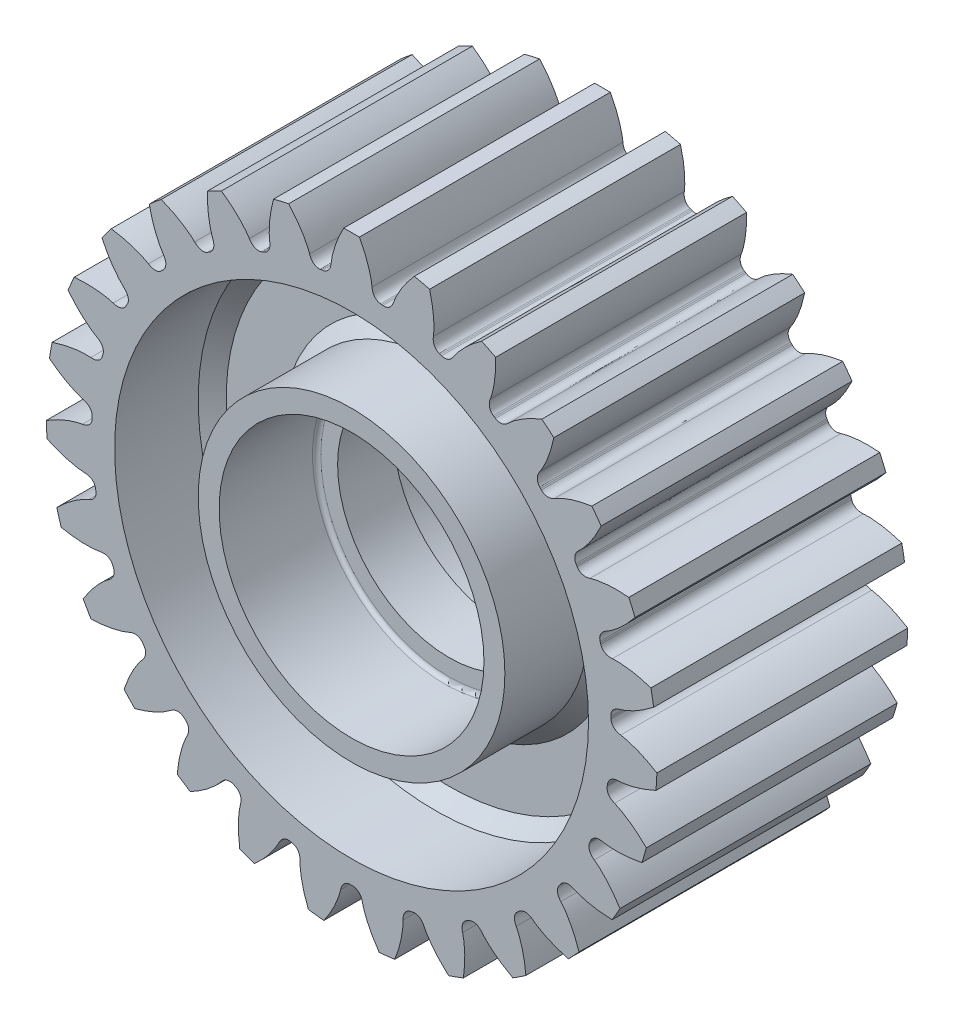
from build123d import *

# Parameters (mm, degrees)
BOSS_EXTRUDE1_DEPTH      = 9
BOSS_EXTRUDE1_DEPTH_BACK = 9
SKETCH1_R                = 21.914381428
SKETCH1_R_2              = 9.5
CUT_EXTRUDE1_START       = -9
CUT_EXTRUDE1_DEPTH       = 18
CIRPATTERN1_COUNT        = 27
SKETCH4_R                = 17
SKETCH4_R_2              = 11
CUT_EXTRUDE2_DEPTH       = 7
SKETCH5_R                = 9.5
SKETCH5_R_2              = 8
BOSS_EXTRUDE2_DEPTH      = 2
FILLET1_R                = 0.3
CHAMFER1_SIZE            = 1


with BuildPart() as part:
    # Sketch1 → Boss-Extrude1 (new, two sides: drawn at the far end of the back side and taken through both)
    with BuildSketch(Plane.XY.offset(-BOSS_EXTRUDE1_DEPTH_BACK)):
        Circle(SKETCH1_R)
        Circle(SKETCH1_R_2, mode=Mode.SUBTRACT)
    extrude(amount=BOSS_EXTRUDE1_DEPTH + BOSS_EXTRUDE1_DEPTH_BACK)

    # Sketch2 → Cut-Extrude1 (cut)
    with BuildSketch(Plane.XY.offset(CUT_EXTRUDE1_START)):
        with BuildLine():
            Line((4.505951185, 21.44613059), (4.686189233, 22.303975813))
            ThreePointArc((4.686189233, 22.303975813), (2.645868577, 22.636852389), (0.583778408, 22.783478869))
            Line((0.583778408, 22.783478869), (0.561325392, 21.90719122))
            add(Edge.make_bspline(
                [(0.561325392, 21.90719122), (0.901912955, 21.27379185), (1.144883834, 20.701392913), (1.304998336, 20.204376055), (1.399601516, 19.794022473), (1.447668009, 19.477859734), (1.468779104, 19.259517553)],
                knots=[0, 0, 0, 0, 0, 0, 0, 1, 1, 1, 1, 1, 1, 1], degree=6))
            add(Edge.make_bspline(
                [(1.468779104, 19.259517553), (1.473823555, 19.207435737), (1.487311572, 19.117065795), (1.520150645, 18.998887895), (1.556932305, 18.908626101), (1.596693678, 18.835297543), (1.639512269, 18.773132027), (1.685399682, 18.719433686), (1.734265471, 18.672870639), (1.785927305, 18.632779186), (1.840130581, 18.598840912), (1.896564551, 18.570922379), (1.954876874, 18.548987698), (2.01468483, 18.533051239), (2.055306222, 18.526446364), (2.075699496, 18.524161447)],
                knots=[0, 0, 0, 0, 0.15130925, 0.263634106, 0.354006345, 0.432663028, 0.504456078, 0.571945992, 0.636608707, 0.699351989, 0.760769183, 0.821271721, 0.881160382, 0.940670548, 1, 1, 1, 1], degree=3))
            add(Edge.make_bspline(
                [(2.075699496, 18.524161447), (2.105135229, 18.520863067), (2.1345631, 18.517494524), (2.163982774, 18.514055857)],
                knots=[0, 0, 0, 0, 1, 1, 1, 1], degree=3))
            add(Edge.make_bspline(
                [(2.163982774, 18.514055857), (2.193402448, 18.51061719), (2.222813926, 18.507108399), (2.252216874, 18.503529525)],
                knots=[0, 0, 0, 0, 1, 1, 1, 1], degree=3))
            add(Edge.make_bspline(
                [(2.252216874, 18.503529525), (2.272587383, 18.501049839), (2.313637009, 18.49810874), (2.375508034, 18.499822966), (2.437307027, 18.507718648), (2.498658269, 18.521870064), (2.559227193, 18.542393392), (2.618742201, 18.569490136), (2.677028984, 18.603528844), (2.734063186, 18.645197373), (2.79006395, 18.695812563), (2.845664279, 18.757994937), (2.902270288, 18.837341278), (2.961477878, 18.944760465), (2.995443067, 19.029583923), (3.012362437, 19.079098537)],
                knots=[0, 0, 0, 0, 0.059329452, 0.118839618, 0.178728279, 0.239230817, 0.300648011, 0.363391293, 0.428054008, 0.495543922, 0.567336972, 0.645993655, 0.736365894, 0.84869075, 1, 1, 1, 1], degree=3))
            add(Edge.make_bspline(
                [(3.012362437, 19.079098537), (3.083257653, 19.286686722), (3.202940652, 19.583242357), (3.38962784, 19.960717812), (3.66004641, 20.40741257), (4.028472257, 20.908349479), (4.505951185, 21.44613059)],
                knots=[0, 0, 0, 0, 0, 0, 0, 1, 1, 1, 1, 1, 1, 1], degree=6))
        make_face()
    cut_extrude1 = extrude(amount=CUT_EXTRUDE1_DEPTH, mode=Mode.SUBTRACT)

    # CirPattern1: Cut-Extrude1 ×27 about axis
    cirpattern1_axis = Axis((0, 0, -9), (0, 0, 1))
    for i in range(1, CIRPATTERN1_COUNT):
        add(cut_extrude1.rotate(cirpattern1_axis, i * 360 / CIRPATTERN1_COUNT), mode=Mode.SUBTRACT)

    # Sketch4 → Cut-Extrude2 (cut)
    with BuildSketch(Plane.XY.offset(9)):
        Circle(SKETCH4_R)
        Circle(SKETCH4_R_2, mode=Mode.SUBTRACT)
    cut_extrude2 = extrude(amount=-CUT_EXTRUDE2_DEPTH, mode=Mode.SUBTRACT)

    # Sketch5 → Boss-Extrude2 (add, symmetric)
    with BuildSketch(Plane.XY):
        Circle(SKETCH5_R)
        Circle(SKETCH5_R_2, mode=Mode.SUBTRACT)
    extrude(amount=BOSS_EXTRUDE2_DEPTH, both=True)

    # Fillet1
    fillet1_edges = [part.edges().sort_by_distance(p)[0] for p in [
        (-9.5, 0, 2),
        (-9.5, 0, -2),
    ]]
    fillet(fillet1_edges, radius=FILLET1_R)

    # Mirror3: Cut-Extrude2 across plane
    add(cut_extrude2.mirror(Plane.XY), mode=Mode.SUBTRACT)

    # Chamfer1
    chamfer1_edges = [part.edges().sort_by_distance(p)[0] for p in [
        (-17, 0, 2),
        (-11, 0, 2),
        (-17, 0, -2),
        (-11, 0, -2),
    ]]
    chamfer(chamfer1_edges, length=CHAMFER1_SIZE)


solid = part.part
